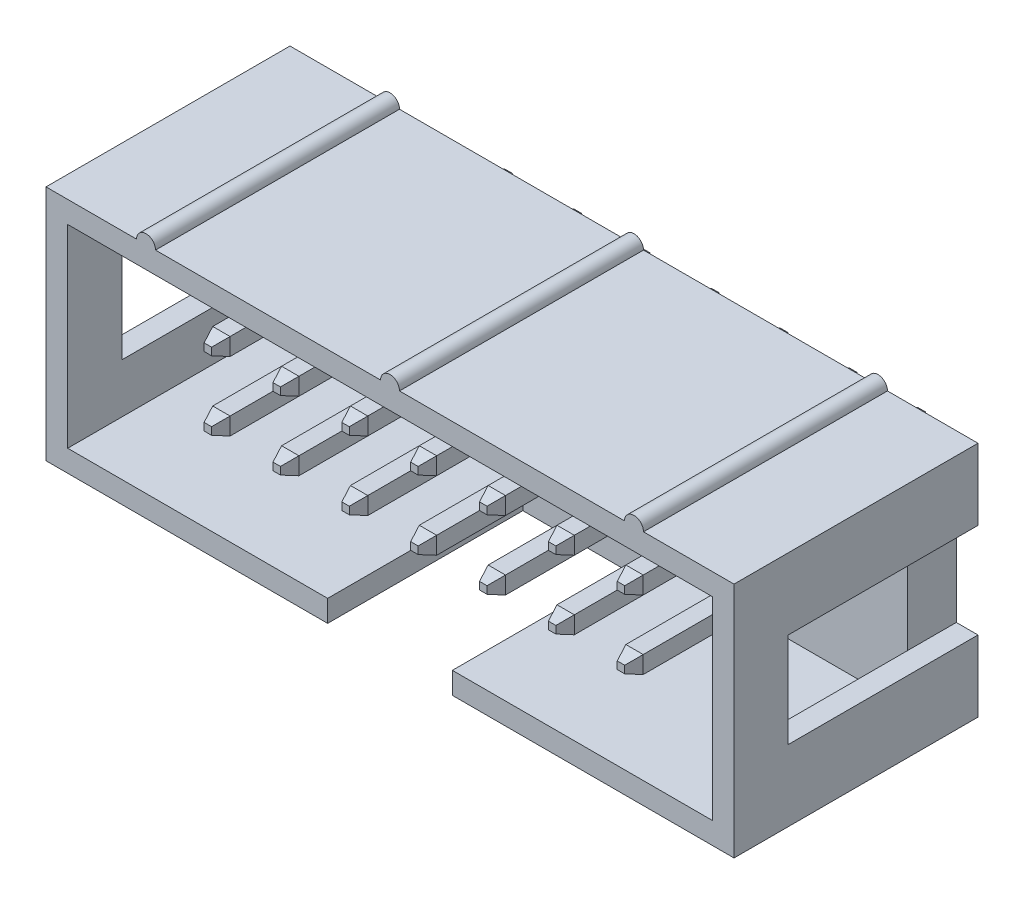
from build123d import *
from OCP.BRepFilletAPI import BRepFilletAPI_MakeChamfer

# Parameters (mm, degrees)
SKETCH_1_W               = 25.38
SKETCH_1_H               = 8.75
EXTRUDE_1_DEPTH          = 1.8
SKETCH_2_W               = 25.38
SKETCH_2_H               = 8.75
SKETCH_2_W_2             = 23.78
SKETCH_2_H_2             = 7.15
EXTRUDE_2_DEPTH          = 7.2
CUT_EXTRUDE_START        = -1.8
SKETCH_3_W               = 0.8
SKETCH_3_H               = 3.5
CUT_EXTRUDE_1_DEPTH      = 7
SKETCH_4_W               = 4.6
SKETCH_4_H               = 0.8
CUT_EXTRUDE_2_DEPTH      = 7.2
EXTRUDE_3_DEPTH          = 6.3
EXTRUDE_3_DEPTH_BACK     = 4.8
SKETCH_5_W               = 0.64
SKETCH_5_H               = 0.64
CHAMFER_2_SIZE           = 0.5
CHAMFER_2_SIZE2          = 0.181985117
CHAMFER_8_SIZE           = 0.5
CHAMFER_8_SIZE2          = 0.181985117
CUT_EXTRUDE_3_DEPTH      = 0.1
PATTERN_LINEAR_1_COUNT   = 4
PATTERN_LINEAR_1_PITCH   = 2.54
PATTERN_LINEAR_1_2_COUNT = 2
PATTERN_LINEAR_1_2_PITCH = 2.54
SKETCH_7_R               = 0.35
EXTRUDE_4_DEPTH          = 9


with BuildPart() as part:
    # Эскиз1 → Бобышка-Вытянуть1 (new body)
    with BuildSketch(Plane.XY):
        Rectangle(SKETCH_1_W, SKETCH_1_H)
    extrude(amount=EXTRUDE_1_DEPTH)

    # Эскиз2 → Бобышка-Вытянуть2 (add)
    with BuildSketch(Plane.XY.offset(1.8)):
        Rectangle(SKETCH_2_W, SKETCH_2_H)
        Rectangle(SKETCH_2_W_2, SKETCH_2_H_2, mode=Mode.SUBTRACT)
    extrude(amount=EXTRUDE_2_DEPTH)

    # Эскиз3 → Вырез-Вытянуть1 (cut)
    with BuildSketch(Plane.XY.offset(1.8).offset(CUT_EXTRUDE_START)):
        with Locations((12.29, 0)):
            Rectangle(SKETCH_3_W, SKETCH_3_H)
        with Locations((-12.29, 0)):
            Rectangle(SKETCH_3_W, SKETCH_3_H)
    extrude(amount=CUT_EXTRUDE_1_DEPTH, mode=Mode.SUBTRACT)

    # Эскиз4 → Вырез-Вытянуть2 (cut)
    with BuildSketch(Plane.XY.offset(9)):
        with Locations((0, -3.975)):
            Rectangle(SKETCH_4_W, SKETCH_4_H)
    extrude(amount=-CUT_EXTRUDE_2_DEPTH, mode=Mode.SUBTRACT)

    # Эскиз6 → Вырез-Вытянуть3 (cut)
    with BuildSketch(Plane.XZ.offset(4.375)):
        Polygon((-4.976440372, 5.189720174), (-3.184624847, 5.189720174), (-4.08053261, 3.716247509), align=None)
    extrude(amount=-CUT_EXTRUDE_3_DEPTH, mode=Mode.SUBTRACT)

    # Эскиз7 → Бобышка-Вытянуть4 (add)
    with BuildSketch(Plane.XY.offset(9)):
        with Locations((0, 4.375)):
            Circle(SKETCH_7_R)
        with Locations((9, 4.375)):
            Circle(SKETCH_7_R)
        with Locations((-9, 4.375)):
            Circle(SKETCH_7_R)
    extrude(amount=-EXTRUDE_4_DEPTH)


with BuildPart() as body_2:
    # Эскиз5 → Бобышка-Вытянуть3 (new, two sides: drawn at the far end of the back side and taken through both)
    with BuildSketch(Plane.XY.offset(1.8).offset(-EXTRUDE_3_DEPTH_BACK)):
        with Locations((0, 1.27)):
            Rectangle(SKETCH_5_W, SKETCH_5_H)
    extrude(amount=EXTRUDE_3_DEPTH + EXTRUDE_3_DEPTH_BACK)

    # Фаска2: one chamfer whose edges measure the first distance from different faces: ONE call of the kernel's chamfer builder (chamfer() names one face for all edges)
    chamfer_2_edges_1 = [body_2.edges().sort_by_distance(p)[0] for p in [
        (-0.32, 1.27, -3),
    ]]
    chamfer_2_side_1 = [body_2.faces().sort_by_distance(p)[0] for p in [
        (-0.32, 1.27, 2.55),
    ]]
    chamfer_2_edges_2 = [body_2.edges().sort_by_distance(p)[0] for p in [
        (0, 1.59, -3),
    ]]
    chamfer_2_side_2 = [body_2.faces().sort_by_distance(p)[0] for p in [
        (0, 1.59, 2.55),
    ]]
    chamfer_2_edges_3 = [body_2.edges().sort_by_distance(p)[0] for p in [
        (0.32, 1.27, -3),
    ]]
    chamfer_2_side_3 = [body_2.faces().sort_by_distance(p)[0] for p in [
        (0.32, 1.27, 2.55),
    ]]
    chamfer_2_edges_4 = [body_2.edges().sort_by_distance(p)[0] for p in [
        (0, 0.95, -3),
    ]]
    chamfer_2_side_4 = [body_2.faces().sort_by_distance(p)[0] for p in [
        (0, 0.95, 2.55),
    ]]
    chamfer_2 = BRepFilletAPI_MakeChamfer(body_2.part.solid().wrapped)
    for e in chamfer_2_edges_1:
        chamfer_2.Add(CHAMFER_2_SIZE, CHAMFER_2_SIZE2, e.wrapped, chamfer_2_side_1[0].wrapped)  # the first distance lies on this face
    for e in chamfer_2_edges_2:
        chamfer_2.Add(CHAMFER_2_SIZE, CHAMFER_2_SIZE2, e.wrapped, chamfer_2_side_2[0].wrapped)  # the first distance lies on this face
    for e in chamfer_2_edges_3:
        chamfer_2.Add(CHAMFER_2_SIZE, CHAMFER_2_SIZE2, e.wrapped, chamfer_2_side_3[0].wrapped)  # the first distance lies on this face
    for e in chamfer_2_edges_4:
        chamfer_2.Add(CHAMFER_2_SIZE, CHAMFER_2_SIZE2, e.wrapped, chamfer_2_side_4[0].wrapped)  # the first distance lies on this face
    add(Compound.cast(chamfer_2.Shape()), mode=Mode.REPLACE)

    # Фаска8: one chamfer whose edges measure the first distance from different faces: ONE call of the kernel's chamfer builder (chamfer() names one face for all edges)
    chamfer_8_edges_1 = [body_2.edges().sort_by_distance(p)[0] for p in [
        (0, 1.59, 8.1),
    ]]
    chamfer_8_side_1 = [body_2.faces().sort_by_distance(p)[0] for p in [
        (0, 1.59, 2.8),
    ]]
    chamfer_8_edges_2 = [body_2.edges().sort_by_distance(p)[0] for p in [
        (0.32, 1.27, 8.1),
    ]]
    chamfer_8_side_2 = [body_2.faces().sort_by_distance(p)[0] for p in [
        (0.32, 1.27, 2.8),
    ]]
    chamfer_8_edges_3 = [body_2.edges().sort_by_distance(p)[0] for p in [
        (0, 0.95, 8.1),
    ]]
    chamfer_8_side_3 = [body_2.faces().sort_by_distance(p)[0] for p in [
        (0, 0.95, 2.8),
    ]]
    chamfer_8_edges_4 = [body_2.edges().sort_by_distance(p)[0] for p in [
        (-0.32, 1.27, 8.1),
    ]]
    chamfer_8_side_4 = [body_2.faces().sort_by_distance(p)[0] for p in [
        (-0.32, 1.27, 2.8),
    ]]
    chamfer_8 = BRepFilletAPI_MakeChamfer(body_2.part.solid().wrapped)
    for e in chamfer_8_edges_1:
        chamfer_8.Add(CHAMFER_8_SIZE, CHAMFER_8_SIZE2, e.wrapped, chamfer_8_side_1[0].wrapped)  # the first distance lies on this face
    for e in chamfer_8_edges_2:
        chamfer_8.Add(CHAMFER_8_SIZE, CHAMFER_8_SIZE2, e.wrapped, chamfer_8_side_2[0].wrapped)  # the first distance lies on this face
    for e in chamfer_8_edges_3:
        chamfer_8.Add(CHAMFER_8_SIZE, CHAMFER_8_SIZE2, e.wrapped, chamfer_8_side_3[0].wrapped)  # the first distance lies on this face
    for e in chamfer_8_edges_4:
        chamfer_8.Add(CHAMFER_8_SIZE, CHAMFER_8_SIZE2, e.wrapped, chamfer_8_side_4[0].wrapped)  # the first distance lies on this face
    add(Compound.cast(chamfer_8.Shape()), mode=Mode.REPLACE)


with BuildPart() as pattern_linear_1_1:
    # Линейный массив1: pattern copy
    add(body_2.part.moved(Location(Vector(-1, 0, 0) * (1 * PATTERN_LINEAR_1_PITCH))))


with BuildPart() as pattern_linear_1_2:
    # Линейный массив1: pattern copy
    add(body_2.part.moved(Location(Vector(-1, 0, 0) * (2 * PATTERN_LINEAR_1_PITCH))))


with BuildPart() as pattern_linear_1_3:
    # Линейный массив1: pattern copy
    add(body_2.part.moved(Location(Vector(-1, 0, 0) * (3 * PATTERN_LINEAR_1_PITCH))))


with BuildPart() as pattern_linear_1_2_1:
    # Pattern Linear 1 2: pattern copy
    add(body_2.part.moved(Location(Vector(0, -1, 0) * (1 * PATTERN_LINEAR_1_2_PITCH))))


with BuildPart() as pattern_linear_1_2_2:
    # Pattern Linear 1 2: pattern copy
    add(pattern_linear_1_1.part.moved(Location(Vector(0, -1, 0) * (1 * PATTERN_LINEAR_1_2_PITCH))))


with BuildPart() as pattern_linear_1_2_3:
    # Pattern Linear 1 2: pattern copy
    add(pattern_linear_1_2.part.moved(Location(Vector(0, -1, 0) * (1 * PATTERN_LINEAR_1_2_PITCH))))


with BuildPart() as pattern_linear_1_2_4:
    # Pattern Linear 1 2: pattern copy
    add(pattern_linear_1_3.part.moved(Location(Vector(0, -1, 0) * (1 * PATTERN_LINEAR_1_2_PITCH))))


with BuildPart() as body_10:
    # Линейный массив2: read off the stored shape, not the designer's step
    # Линейный массив2: copy of Линейный массив1 2_4
    add(pattern_linear_1_2_4.part.moved(Location((15.24, 2.54, 0))))


with BuildPart() as body_11:
    # Pattern Linear 2 2: copy of Линейный массив1 2_4
    add(pattern_linear_1_2_4.part.moved(Location((12.7, 2.54, 0))))


with BuildPart() as body_12:
    # Pattern Linear 2 3: copy of Линейный массив1 2_4
    add(pattern_linear_1_2_4.part.moved(Location((10.16, 2.54, 0))))


with BuildPart() as body_13:
    # Pattern Linear 2 4: copy of Линейный массив1 2_4
    add(pattern_linear_1_2_4.part.moved(Location((15.24, 0, 0))))


with BuildPart() as body_14:
    # Pattern Linear 2 5: copy of Линейный массив1 2_4
    add(pattern_linear_1_2_4.part.moved(Location((12.7, 0, 0))))


with BuildPart() as body_15:
    # Pattern Linear 2 6: copy of Линейный массив1 2_4
    add(pattern_linear_1_2_4.part.moved(Location((10.16, 0, 0))))


solid = Compound([part.part, body_2.part, pattern_linear_1_1.part, pattern_linear_1_2.part, pattern_linear_1_3.part, pattern_linear_1_2_1.part, pattern_linear_1_2_2.part, pattern_linear_1_2_3.part, pattern_linear_1_2_4.part, body_10.part, body_11.part, body_12.part, body_13.part, body_14.part, body_15.part])
